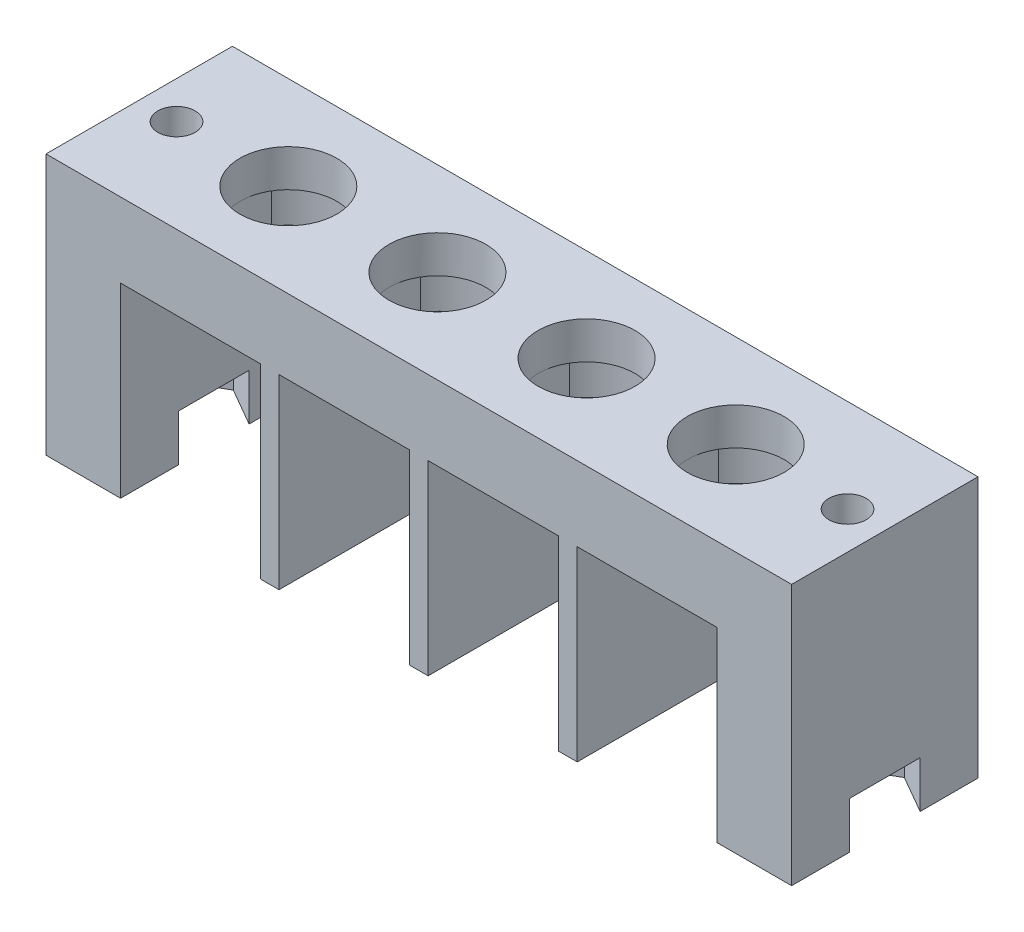
from build123d import *

# Parameters (mm, degrees)
SKETCH1_W           = 40
SKETCH1_H           = 10
BOSS_EXTRUDE1_DEPTH = 4
SKETCH2_R           = 2.6
CUT_EXTRUDE1_DEPTH  = 10
CUT_EXTRUDE4_DEPTH  = 2
BOSS_EXTRUDE4_DEPTH = 10
SKETCH6_R           = 1
CUT_EXTRUDE5_DEPTH  = 40
CUT_EXTRUDE6_DEPTH  = 2.5


with BuildPart() as part:
    # Sketch1 → Boss-Extrude1 (new body)
    with BuildSketch(Plane(origin=(0, 0, 0), x_dir=(1, 0, 0), z_dir=(0, 1, 0))):
        with Locations((-5, -2.382550336)):
            Rectangle(SKETCH1_W, SKETCH1_H)
    extrude(amount=BOSS_EXTRUDE1_DEPTH)

    # Sketch2 → Cut-Extrude1 (cut)
    with BuildSketch(Plane(origin=(0, 4, 0), x_dir=(1, 0, 0), z_dir=(0, 1, 0))):
        with Locations((-17, -2.382550336)):
            Circle(SKETCH2_R)
        with Locations((-9, -2.382550336)):
            Circle(SKETCH2_R)
        with Locations((-1, -2.382550336)):
            Circle(SKETCH2_R)
        with Locations((7, -2.382550336)):
            Circle(SKETCH2_R)
    extrude(amount=-CUT_EXTRUDE1_DEPTH, mode=Mode.SUBTRACT)

    # Sketch3 → Cut-Extrude4 (cut)
    with BuildSketch(Plane.XZ):
        with BuildLine():
            Line((-19.6, 4.070744637), (-19.6, 0.694356034))
            ThreePointArc((-19.6, 0.694356034), (-13.9, 2.382550336), (-19.6, 4.070744637))
        make_face()
        with BuildLine():
            Line((-11.6, 4.070744637), (-11.6, 0.694356034))
            ThreePointArc((-11.6, 0.694356034), (-5.9, 2.382550336), (-11.6, 4.070744637))
        make_face()
        with BuildLine():
            Line((-3.6, 4.070744637), (-3.6, 0.694356034))
            ThreePointArc((-3.6, 0.694356034), (2.1, 2.382550336), (-3.6, 4.070744637))
        make_face()
        with BuildLine():
            Line((4.4, 4.070744637), (4.4, 0.694356034))
            ThreePointArc((4.4, 0.694356034), (10.1, 2.382550336), (4.4, 4.070744637))
        make_face()
    extrude(amount=-CUT_EXTRUDE4_DEPTH, mode=Mode.SUBTRACT)

    # Sketch5 → Boss-Extrude4 (add)
    with BuildSketch(Plane.XZ):
        Polygon((-25, -1.617449664), (-25, -2.617449664), (15, -2.617449664), (15, -1.617449664), (15, 7.382550336), (11, 7.382550336), (11, -1.617449664), (3.5, -1.617449664), (3.5, 7.382550336), (2.5, 7.382550336), (2.5, -1.617449664), (-4.5, -1.617449664), (-4.5, 7.382550336), (-5.5, 7.382550336), (-5.5, -1.617449664), (-12.5, -1.617449664), (-12.5, 7.382550336), (-13.5, 7.382550336), (-13.5, -1.617449664), (-21, -1.617449664), (-21, 7.382550336), (-25, 7.382550336), align=None)
    extrude(amount=BOSS_EXTRUDE4_DEPTH)

    # Sketch6 → Cut-Extrude5 (cut)
    with BuildSketch(Plane.XZ.offset(10)):
        with Locations((-23, 2.382550336)):
            Circle(SKETCH6_R)
        with Locations((13, 2.382550336)):
            Circle(SKETCH6_R)
    extrude(amount=-CUT_EXTRUDE5_DEPTH, mode=Mode.SUBTRACT)

    # Sketch8 → Cut-Extrude6 (cut)
    with BuildSketch(Plane.XZ.offset(10)):
        Polygon((13, 5.432550336), (10.358622518, 3.907550336), (10.358622518, 0.857550336), (13, -0.667449664), (15.641377482, 0.857550336), (15.641377482, 3.907550336), align=None)
        Polygon((-23, 5.432550336), (-25.641377482, 3.907550336), (-25.641377482, 0.857550336), (-23, -0.667449664), (-20.358622518, 0.857550336), (-20.358622518, 3.907550336), align=None)
    extrude(amount=-CUT_EXTRUDE6_DEPTH, mode=Mode.SUBTRACT)


solid = part.part
